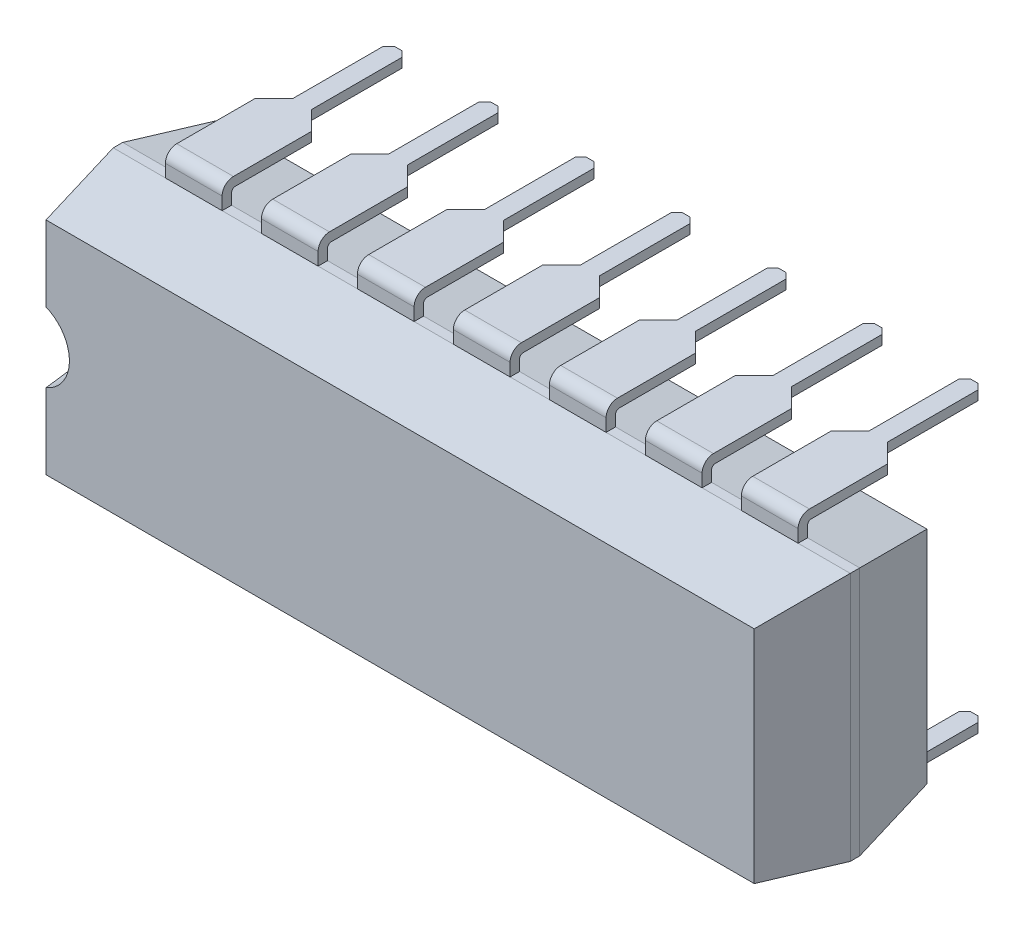
from build123d import *

# Parameters (mm, degrees)
SZKIC1_W                   = 9.75
SZKIC1_H                   = 3.3
WYCI_GNI_CIE1_DEPTH        = 5.08
SZKIC2_W                   = 9.75
SZKIC2_H                   = 5.08
WYCI_GNI_CIE2_DEPTH        = 3.3
SZKIC3_W                   = 5.08
SZKIC3_H                   = 6.6
WYCI_GNI_CIE3_DEPTH        = 9.75
SZKIC6_W                   = 19.5
SZKIC6_H                   = 6.6
WYTNIJ_WYCI_GNI_CIE1_DEPTH = 0.51
SFAZOWANIE1_SIZE           = 2.16
SFAZOWANIE1_SIZE2          = 0.380866278
SFAZOWANIE2_SIZE           = 2.16
SFAZOWANIE2_SIZE2          = 0.380866278
SFAZOWANIE3_SIZE           = 2.16
SFAZOWANIE3_SIZE2          = 0.380866278
SFAZOWANIE4_SIZE           = 2.16
SFAZOWANIE4_SIZE2          = 0.380866278
SFAZOWANIE5_SIZE           = 2.16
SFAZOWANIE5_SIZE2          = 0.380866278
SFAZOWANIE6_SIZE           = 2.16
SFAZOWANIE6_SIZE2          = 0.380866278
SFAZOWANIE8_SIZE           = 2.16
SFAZOWANIE8_SIZE2          = 0.380866278
SFAZOWANIE9_SIZE           = 2.16
SFAZOWANIE9_SIZE2          = 0.380866278
SZKIC8_R                   = 1
WYTNIJ_WYCI_GNI_CIE3_DEPTH = 1.3
SZKIC9_W                   = 1.5
SZKIC9_H                   = 0.25
WYCI_GNI_CIE4_DEPTH        = 0.635
SZKIC10_W                  = 1.5
SZKIC10_H                  = 0.25
WYCI_GNI_CIE5_DEPTH        = 2.62
SFAZOWANIE10_SIZE          = 0.5
SFAZOWANIE11_SIZE          = 0.5
SFAZOWANIE12_SIZE          = 0.5
SFAZOWANIE13_SIZE          = 0.5
SFAZOWANIE14_SIZE          = 0.5
SFAZOWANIE15_SIZE          = 0.5
SFAZOWANIE16_SIZE          = 0.5
SFAZOWANIE17_SIZE          = 0.5
SFAZOWANIE18_SIZE          = 0.5
SFAZOWANIE19_SIZE          = 0.5
SFAZOWANIE20_SIZE          = 0.5
SFAZOWANIE21_SIZE          = 0.5
SFAZOWANIE22_SIZE          = 0.5
SFAZOWANIE23_SIZE          = 0.5
SZKIC12_W                  = 0.5
SZKIC12_H                  = 0.25
WYCI_GNI_CIE6_DEPTH        = 2.54
SFAZOWANIE24_SIZE          = 0.15
SFAZOWANIE25_SIZE          = 0.15
SFAZOWANIE26_SIZE          = 0.15
SFAZOWANIE27_SIZE          = 0.15
SFAZOWANIE28_SIZE          = 0.15
SFAZOWANIE29_SIZE          = 0.15
SFAZOWANIE30_SIZE          = 0.15
SFAZOWANIE31_SIZE          = 0.15
SFAZOWANIE32_SIZE          = 0.15
SFAZOWANIE33_SIZE          = 0.15
SFAZOWANIE34_SIZE          = 0.15
SFAZOWANIE35_SIZE          = 0.15
SFAZOWANIE36_SIZE          = 0.15
SFAZOWANIE37_SIZE          = 0.15
SZKIC13_W                  = 1.5
SZKIC13_H                  = 0.25
WYCI_GNI_CIE7_DEPTH        = 0.635
SZKIC14_W                  = 1.5
SZKIC14_H                  = 0.25
WYCI_GNI_CIE8_DEPTH        = 2.62
SFAZOWANIE38_SIZE          = 0.5
SFAZOWANIE39_SIZE          = 0.5
SFAZOWANIE40_SIZE          = 0.5
SFAZOWANIE41_SIZE          = 0.5
SFAZOWANIE42_SIZE          = 0.5
SFAZOWANIE43_SIZE          = 0.5
SFAZOWANIE44_SIZE          = 0.5
SFAZOWANIE45_SIZE          = 0.5
SFAZOWANIE46_SIZE          = 0.5
SFAZOWANIE47_SIZE          = 0.5
SFAZOWANIE48_SIZE          = 0.5
SFAZOWANIE49_SIZE          = 0.5
SFAZOWANIE50_SIZE          = 0.5
SFAZOWANIE51_SIZE          = 0.5
SZKIC15_W                  = 0.5
SZKIC15_H                  = 0.25
WYCI_GNI_CIE9_DEPTH        = 2.54
SFAZOWANIE52_SIZE          = 0.15
SFAZOWANIE53_SIZE          = 0.15
SFAZOWANIE54_SIZE          = 0.15
SFAZOWANIE55_SIZE          = 0.15
SFAZOWANIE56_SIZE          = 0.15
SFAZOWANIE57_SIZE          = 0.15
SFAZOWANIE58_SIZE          = 0.15
SFAZOWANIE59_SIZE          = 0.15
SFAZOWANIE60_SIZE          = 0.15
SFAZOWANIE61_SIZE          = 0.15
SFAZOWANIE62_SIZE          = 0.15
SFAZOWANIE63_SIZE          = 0.15
SFAZOWANIE64_SIZE          = 0.15
SFAZOWANIE65_SIZE          = 0.15
ZAOKR_GLENIE1_R            = 0.3
ZAOKR_GLENIE2_R            = 0.3
ZAOKR_GLENIE3_R            = 0.3
ZAOKR_GLENIE4_R            = 0.3
ZAOKR_GLENIE5_R            = 0.3
ZAOKR_GLENIE6_R            = 0.3
ZAOKR_GLENIE7_R            = 0.3
ZAOKR_GLENIE8_R            = 0.3
ZAOKR_GLENIE9_R            = 0.3
ZAOKR_GLENIE10_R           = 0.3
ZAOKR_GLENIE11_R           = 0.3
ZAOKR_GLENIE12_R           = 0.3
ZAOKR_GLENIE13_R           = 0.3
ZAOKR_GLENIE14_R           = 0.3
ZAOKR_GLENIE15_R           = 0.1
ZAOKR_GLENIE16_R           = 0.1
ZAOKR_GLENIE17_R           = 0.1
ZAOKR_GLENIE18_R           = 0.1
ZAOKR_GLENIE19_R           = 0.1
ZAOKR_GLENIE20_R           = 0.1
ZAOKR_GLENIE21_R           = 0.1
ZAOKR_GLENIE22_R           = 0.1
ZAOKR_GLENIE23_R           = 0.1
ZAOKR_GLENIE24_R           = 0.1
ZAOKR_GLENIE25_R           = 0.1
ZAOKR_GLENIE26_R           = 0.1
ZAOKR_GLENIE27_R           = 0.1
ZAOKR_GLENIE28_R           = 0.1


with BuildPart() as part:
    # Szkic1 → Wyciągnięcie1 (new body)
    with BuildSketch(Plane.XY):
        with Locations((4.875, 1.65)):
            Rectangle(SZKIC1_W, SZKIC1_H)
    extrude(amount=WYCI_GNI_CIE1_DEPTH)

    # Szkic2 → Wyciągnięcie2 (add)
    with BuildSketch(Plane.XZ):
        with Locations((4.875, 2.54)):
            Rectangle(SZKIC2_W, SZKIC2_H)
    extrude(amount=WYCI_GNI_CIE2_DEPTH)

    # Szkic3 → Wyciągnięcie3 (add)
    with BuildSketch(Plane.ZY):
        with Locations((2.54, 0)):
            Rectangle(SZKIC3_W, SZKIC3_H)
    extrude(amount=WYCI_GNI_CIE3_DEPTH)

    # Szkic6 → Wytnij-wyciągnięcie1 (cut)
    with BuildSketch(Plane(origin=(0, 0, 0), x_dir=(-1, 0, 0), z_dir=(0, 0, -1))):
        Rectangle(SZKIC6_W, SZKIC6_H)
    extrude(amount=-WYTNIJ_WYCI_GNI_CIE1_DEPTH, mode=Mode.SUBTRACT)

    # Sfazowanie1
    sfazowanie1_edges = [part.edges().sort_by_distance(p)[0] for p in [
        (0, -3.3, 5.08),
    ]]
    sfazowanie1_side = [part.faces().sort_by_distance(p)[0] for p in [
        (0, -3.3, 2.795),
    ]]
    chamfer(sfazowanie1_edges, length=SFAZOWANIE1_SIZE, length2=SFAZOWANIE1_SIZE2, reference=sfazowanie1_side[0])

    # Sfazowanie2
    sfazowanie2_edges = [part.edges().sort_by_distance(p)[0] for p in [
        (0, -3.3, 0.51),
    ]]
    sfazowanie2_side = [part.faces().sort_by_distance(p)[0] for p in [
        (0, -3.3, 1.715),
    ]]
    chamfer(sfazowanie2_edges, length=SFAZOWANIE2_SIZE, length2=SFAZOWANIE2_SIZE2, reference=sfazowanie2_side[0])

    # Sfazowanie3
    sfazowanie3_edges = [part.edges().sort_by_distance(p)[0] for p in [
        (9.75, 0.190433139, 5.08),
    ]]
    sfazowanie3_side = [part.faces().sort_by_distance(p)[0] for p in [
        (9.75, 0.088971778, 2.795),
    ]]
    chamfer(sfazowanie3_edges, length=SFAZOWANIE3_SIZE, length2=SFAZOWANIE3_SIZE2, reference=sfazowanie3_side[0])

    # Sfazowanie4
    sfazowanie4_edges = [part.edges().sort_by_distance(p)[0] for p in [
        (9.75, 0.190433139, 0.51),
    ]]
    sfazowanie4_side = [part.faces().sort_by_distance(p)[0] for p in [
        (9.75, 0.084234553, 1.727875255),
    ]]
    chamfer(sfazowanie4_edges, length=SFAZOWANIE4_SIZE, length2=SFAZOWANIE4_SIZE2, reference=sfazowanie4_side[0])

    # Sfazowanie5
    sfazowanie5_edges = [part.edges().sort_by_distance(p)[0] for p in [
        (-0.190433139, 3.3, 5.08),
    ]]
    sfazowanie5_side = [part.faces().sort_by_distance(p)[0] for p in [
        (-0.089663523, 3.3, 2.795),
    ]]
    chamfer(sfazowanie5_edges, length=SFAZOWANIE5_SIZE, length2=SFAZOWANIE5_SIZE2, reference=sfazowanie5_side[0])

    # Sfazowanie6
    sfazowanie6_edges = [part.edges().sort_by_distance(p)[0] for p in [
        (-0.190433139, 3.3, 0.51),
    ]]
    sfazowanie6_side = [part.faces().sort_by_distance(p)[0] for p in [
        (-0.08497186, 3.3, 1.719282569),
    ]]
    chamfer(sfazowanie6_edges, length=SFAZOWANIE6_SIZE, length2=SFAZOWANIE6_SIZE2, reference=sfazowanie6_side[0])

    # Sfazowanie8
    sfazowanie8_edges = [part.edges().sort_by_distance(p)[0] for p in [
        (-9.75, 0, 0.51),
    ]]
    sfazowanie8_side = [part.faces().sort_by_distance(p)[0] for p in [
        (-9.75, 0, 2.795),
    ]]
    chamfer(sfazowanie8_edges, length=SFAZOWANIE8_SIZE, length2=SFAZOWANIE8_SIZE2, reference=sfazowanie8_side[0])

    # Sfazowanie9
    sfazowanie9_edges = [part.edges().sort_by_distance(p)[0] for p in [
        (-9.75, 0, 5.08),
    ]]
    sfazowanie9_side = [part.faces().sort_by_distance(p)[0] for p in [
        (-9.75, 0, 3.848547251),
    ]]
    chamfer(sfazowanie9_edges, length=SFAZOWANIE9_SIZE, length2=SFAZOWANIE9_SIZE2, reference=sfazowanie9_side[0])

    # Szkic8 → Wytnij-wyciągnięcie3 (cut)
    with BuildSketch(Plane.XY.offset(5.08)):
        with Locations((-9.75, 0)):
            Circle(SZKIC8_R)
    extrude(amount=-WYTNIJ_WYCI_GNI_CIE3_DEPTH, mode=Mode.SUBTRACT)

    # Szkic9 → Wyciągnięcie4 (add)
    with BuildSketch(Plane(origin=(0, 3.3, 0), x_dir=(-1, 0, 0), z_dir=(0, 1, 0))):
        with Locations((0, 2.795)):
            Rectangle(SZKIC9_W, SZKIC9_H)
        with Locations((-2.54, 2.795)):
            Rectangle(SZKIC9_W, SZKIC9_H)
        with Locations((-5.08, 2.795)):
            Rectangle(SZKIC9_W, SZKIC9_H)
        with Locations((-7.62, 2.795)):
            Rectangle(SZKIC9_W, SZKIC9_H)
        with Locations((2.54, 2.795)):
            Rectangle(SZKIC9_W, SZKIC9_H)
        with Locations((5.08, 2.795)):
            Rectangle(SZKIC9_W, SZKIC9_H)
        with Locations((7.62, 2.795)):
            Rectangle(SZKIC9_W, SZKIC9_H)
    extrude(amount=WYCI_GNI_CIE4_DEPTH)

    # Szkic10 → Wyciągnięcie5 (add)
    with BuildSketch(Plane(origin=(0, 0, 2.67), x_dir=(-1, 0, 0), z_dir=(0, 0, -1))):
        with Locations((0, 3.81)):
            Rectangle(SZKIC10_W, SZKIC10_H)
        with Locations((2.54, 3.81)):
            Rectangle(SZKIC10_W, SZKIC10_H)
        with Locations((5.08, 3.81)):
            Rectangle(SZKIC10_W, SZKIC10_H)
        with Locations((7.62, 3.81)):
            Rectangle(SZKIC10_W, SZKIC10_H)
        with Locations((-2.54, 3.81)):
            Rectangle(SZKIC10_W, SZKIC10_H)
        with Locations((-5.08, 3.81)):
            Rectangle(SZKIC10_W, SZKIC10_H)
        with Locations((-7.62, 3.81)):
            Rectangle(SZKIC10_W, SZKIC10_H)
    extrude(amount=WYCI_GNI_CIE5_DEPTH)

    # Sfazowanie10
    sfazowanie10_edges = [part.edges().sort_by_distance(p)[0] for p in [
        (-8.37, 3.81, 0.05),
    ]]
    chamfer(sfazowanie10_edges, length=SFAZOWANIE10_SIZE)

    # Sfazowanie11
    sfazowanie11_edges = [part.edges().sort_by_distance(p)[0] for p in [
        (-6.87, 3.81, 0.05),
    ]]
    chamfer(sfazowanie11_edges, length=SFAZOWANIE11_SIZE)

    # Sfazowanie12
    sfazowanie12_edges = [part.edges().sort_by_distance(p)[0] for p in [
        (-5.83, 3.81, 0.05),
    ]]
    chamfer(sfazowanie12_edges, length=SFAZOWANIE12_SIZE)

    # Sfazowanie13
    sfazowanie13_edges = [part.edges().sort_by_distance(p)[0] for p in [
        (-4.33, 3.81, 0.05),
    ]]
    chamfer(sfazowanie13_edges, length=SFAZOWANIE13_SIZE)

    # Sfazowanie14
    sfazowanie14_edges = [part.edges().sort_by_distance(p)[0] for p in [
        (-3.29, 3.81, 0.05),
    ]]
    chamfer(sfazowanie14_edges, length=SFAZOWANIE14_SIZE)

    # Sfazowanie15
    sfazowanie15_edges = [part.edges().sort_by_distance(p)[0] for p in [
        (-1.79, 3.81, 0.05),
    ]]
    chamfer(sfazowanie15_edges, length=SFAZOWANIE15_SIZE)

    # Sfazowanie16
    sfazowanie16_edges = [part.edges().sort_by_distance(p)[0] for p in [
        (-0.75, 3.81, 0.05),
    ]]
    chamfer(sfazowanie16_edges, length=SFAZOWANIE16_SIZE)

    # Sfazowanie17
    sfazowanie17_edges = [part.edges().sort_by_distance(p)[0] for p in [
        (0.75, 3.81, 0.05),
    ]]
    chamfer(sfazowanie17_edges, length=SFAZOWANIE17_SIZE)

    # Sfazowanie18
    sfazowanie18_edges = [part.edges().sort_by_distance(p)[0] for p in [
        (1.79, 3.81, 0.05),
    ]]
    chamfer(sfazowanie18_edges, length=SFAZOWANIE18_SIZE)

    # Sfazowanie19
    sfazowanie19_edges = [part.edges().sort_by_distance(p)[0] for p in [
        (3.29, 3.81, 0.05),
    ]]
    chamfer(sfazowanie19_edges, length=SFAZOWANIE19_SIZE)

    # Sfazowanie20
    sfazowanie20_edges = [part.edges().sort_by_distance(p)[0] for p in [
        (4.33, 3.81, 0.05),
    ]]
    chamfer(sfazowanie20_edges, length=SFAZOWANIE20_SIZE)

    # Sfazowanie21
    sfazowanie21_edges = [part.edges().sort_by_distance(p)[0] for p in [
        (5.83, 3.81, 0.05),
    ]]
    chamfer(sfazowanie21_edges, length=SFAZOWANIE21_SIZE)

    # Sfazowanie22
    sfazowanie22_edges = [part.edges().sort_by_distance(p)[0] for p in [
        (6.87, 3.81, 0.05),
    ]]
    chamfer(sfazowanie22_edges, length=SFAZOWANIE22_SIZE)

    # Sfazowanie23
    sfazowanie23_edges = [part.edges().sort_by_distance(p)[0] for p in [
        (8.37, 3.81, 0.05),
    ]]
    chamfer(sfazowanie23_edges, length=SFAZOWANIE23_SIZE)

    # Szkic12 → Wyciągnięcie6 (add)
    with BuildSketch(Plane(origin=(0, 0, 0.05), x_dir=(-1, 0, 0), z_dir=(0, 0, -1))):
        with Locations((0, 3.81)):
            Rectangle(SZKIC12_W, SZKIC12_H)
        with Locations((2.54, 3.81)):
            Rectangle(SZKIC12_W, SZKIC12_H)
        with Locations((5.08, 3.81)):
            Rectangle(SZKIC12_W, SZKIC12_H)
        with Locations((7.62, 3.81)):
            Rectangle(SZKIC12_W, SZKIC12_H)
        with Locations((-2.54, 3.81)):
            Rectangle(SZKIC12_W, SZKIC12_H)
        with Locations((-5.08, 3.81)):
            Rectangle(SZKIC12_W, SZKIC12_H)
        with Locations((-7.62, 3.81)):
            Rectangle(SZKIC12_W, SZKIC12_H)
    extrude(amount=WYCI_GNI_CIE6_DEPTH)

    # Sfazowanie24
    sfazowanie24_edges = [part.edges().sort_by_distance(p)[0] for p in [
        (-7.87, 3.81, -2.49),
    ]]
    chamfer(sfazowanie24_edges, length=SFAZOWANIE24_SIZE)

    # Sfazowanie25
    sfazowanie25_edges = [part.edges().sort_by_distance(p)[0] for p in [
        (-7.37, 3.81, -2.49),
    ]]
    chamfer(sfazowanie25_edges, length=SFAZOWANIE25_SIZE)

    # Sfazowanie26
    sfazowanie26_edges = [part.edges().sort_by_distance(p)[0] for p in [
        (-5.33, 3.81, -2.49),
    ]]
    chamfer(sfazowanie26_edges, length=SFAZOWANIE26_SIZE)

    # Sfazowanie27
    sfazowanie27_edges = [part.edges().sort_by_distance(p)[0] for p in [
        (-4.83, 3.81, -2.49),
    ]]
    chamfer(sfazowanie27_edges, length=SFAZOWANIE27_SIZE)

    # Sfazowanie28
    sfazowanie28_edges = [part.edges().sort_by_distance(p)[0] for p in [
        (-2.79, 3.81, -2.49),
    ]]
    chamfer(sfazowanie28_edges, length=SFAZOWANIE28_SIZE)

    # Sfazowanie29
    sfazowanie29_edges = [part.edges().sort_by_distance(p)[0] for p in [
        (-2.29, 3.81, -2.49),
    ]]
    chamfer(sfazowanie29_edges, length=SFAZOWANIE29_SIZE)

    # Sfazowanie30
    sfazowanie30_edges = [part.edges().sort_by_distance(p)[0] for p in [
        (-0.25, 3.81, -2.49),
    ]]
    chamfer(sfazowanie30_edges, length=SFAZOWANIE30_SIZE)

    # Sfazowanie31
    sfazowanie31_edges = [part.edges().sort_by_distance(p)[0] for p in [
        (0.25, 3.81, -2.49),
    ]]
    chamfer(sfazowanie31_edges, length=SFAZOWANIE31_SIZE)

    # Sfazowanie32
    sfazowanie32_edges = [part.edges().sort_by_distance(p)[0] for p in [
        (2.29, 3.81, -2.49),
    ]]
    chamfer(sfazowanie32_edges, length=SFAZOWANIE32_SIZE)

    # Sfazowanie33
    sfazowanie33_edges = [part.edges().sort_by_distance(p)[0] for p in [
        (2.79, 3.81, -2.49),
    ]]
    chamfer(sfazowanie33_edges, length=SFAZOWANIE33_SIZE)

    # Sfazowanie34
    sfazowanie34_edges = [part.edges().sort_by_distance(p)[0] for p in [
        (4.83, 3.81, -2.49),
    ]]
    chamfer(sfazowanie34_edges, length=SFAZOWANIE34_SIZE)

    # Sfazowanie35
    sfazowanie35_edges = [part.edges().sort_by_distance(p)[0] for p in [
        (5.33, 3.81, -2.49),
    ]]
    chamfer(sfazowanie35_edges, length=SFAZOWANIE35_SIZE)

    # Sfazowanie36
    sfazowanie36_edges = [part.edges().sort_by_distance(p)[0] for p in [
        (7.37, 3.81, -2.49),
    ]]
    chamfer(sfazowanie36_edges, length=SFAZOWANIE36_SIZE)

    # Sfazowanie37
    sfazowanie37_edges = [part.edges().sort_by_distance(p)[0] for p in [
        (7.87, 3.81, -2.49),
    ]]
    chamfer(sfazowanie37_edges, length=SFAZOWANIE37_SIZE)

    # Szkic13 → Wyciągnięcie7 (add)
    with BuildSketch(Plane.XZ.offset(3.3)):
        with Locations((0, 2.795)):
            Rectangle(SZKIC13_W, SZKIC13_H)
        with Locations((2.54, 2.795)):
            Rectangle(SZKIC13_W, SZKIC13_H)
        with Locations((5.08, 2.795)):
            Rectangle(SZKIC13_W, SZKIC13_H)
        with Locations((7.62, 2.795)):
            Rectangle(SZKIC13_W, SZKIC13_H)
        with Locations((-2.54, 2.795)):
            Rectangle(SZKIC13_W, SZKIC13_H)
        with Locations((-5.08, 2.795)):
            Rectangle(SZKIC13_W, SZKIC13_H)
        with Locations((-7.62, 2.795)):
            Rectangle(SZKIC13_W, SZKIC13_H)
    extrude(amount=WYCI_GNI_CIE7_DEPTH)

    # Szkic14 → Wyciągnięcie8 (add)
    with BuildSketch(Plane(origin=(0, 0, 2.67), x_dir=(-1, 0, 0), z_dir=(0, 0, -1))):
        with Locations((0, -3.81)):
            Rectangle(SZKIC14_W, SZKIC14_H)
        with Locations((2.54, -3.81)):
            Rectangle(SZKIC14_W, SZKIC14_H)
        with Locations((5.08, -3.81)):
            Rectangle(SZKIC14_W, SZKIC14_H)
        with Locations((7.62, -3.81)):
            Rectangle(SZKIC14_W, SZKIC14_H)
        with Locations((-2.54, -3.81)):
            Rectangle(SZKIC14_W, SZKIC14_H)
        with Locations((-5.08, -3.81)):
            Rectangle(SZKIC14_W, SZKIC14_H)
        with Locations((-7.62, -3.81)):
            Rectangle(SZKIC14_W, SZKIC14_H)
    extrude(amount=WYCI_GNI_CIE8_DEPTH)

    # Sfazowanie38
    sfazowanie38_edges = [part.edges().sort_by_distance(p)[0] for p in [
        (8.37, -3.81, 0.05),
    ]]
    chamfer(sfazowanie38_edges, length=SFAZOWANIE38_SIZE)

    # Sfazowanie39
    sfazowanie39_edges = [part.edges().sort_by_distance(p)[0] for p in [
        (6.87, -3.81, 0.05),
    ]]
    chamfer(sfazowanie39_edges, length=SFAZOWANIE39_SIZE)

    # Sfazowanie40
    sfazowanie40_edges = [part.edges().sort_by_distance(p)[0] for p in [
        (5.83, -3.81, 0.05),
    ]]
    chamfer(sfazowanie40_edges, length=SFAZOWANIE40_SIZE)

    # Sfazowanie41
    sfazowanie41_edges = [part.edges().sort_by_distance(p)[0] for p in [
        (4.33, -3.81, 0.05),
    ]]
    chamfer(sfazowanie41_edges, length=SFAZOWANIE41_SIZE)

    # Sfazowanie42
    sfazowanie42_edges = [part.edges().sort_by_distance(p)[0] for p in [
        (3.29, -3.81, 0.05),
    ]]
    chamfer(sfazowanie42_edges, length=SFAZOWANIE42_SIZE)

    # Sfazowanie43
    sfazowanie43_edges = [part.edges().sort_by_distance(p)[0] for p in [
        (1.79, -3.81, 0.05),
    ]]
    chamfer(sfazowanie43_edges, length=SFAZOWANIE43_SIZE)

    # Sfazowanie44
    sfazowanie44_edges = [part.edges().sort_by_distance(p)[0] for p in [
        (0.75, -3.81, 0.05),
    ]]
    chamfer(sfazowanie44_edges, length=SFAZOWANIE44_SIZE)

    # Sfazowanie45
    sfazowanie45_edges = [part.edges().sort_by_distance(p)[0] for p in [
        (-0.75, -3.81, 0.05),
    ]]
    chamfer(sfazowanie45_edges, length=SFAZOWANIE45_SIZE)

    # Sfazowanie46
    sfazowanie46_edges = [part.edges().sort_by_distance(p)[0] for p in [
        (-1.79, -3.81, 0.05),
    ]]
    chamfer(sfazowanie46_edges, length=SFAZOWANIE46_SIZE)

    # Sfazowanie47
    sfazowanie47_edges = [part.edges().sort_by_distance(p)[0] for p in [
        (-3.29, -3.81, 0.05),
    ]]
    chamfer(sfazowanie47_edges, length=SFAZOWANIE47_SIZE)

    # Sfazowanie48
    sfazowanie48_edges = [part.edges().sort_by_distance(p)[0] for p in [
        (-4.33, -3.81, 0.05),
    ]]
    chamfer(sfazowanie48_edges, length=SFAZOWANIE48_SIZE)

    # Sfazowanie49
    sfazowanie49_edges = [part.edges().sort_by_distance(p)[0] for p in [
        (-5.83, -3.81, 0.05),
    ]]
    chamfer(sfazowanie49_edges, length=SFAZOWANIE49_SIZE)

    # Sfazowanie50
    sfazowanie50_edges = [part.edges().sort_by_distance(p)[0] for p in [
        (-6.87, -3.81, 0.05),
    ]]
    chamfer(sfazowanie50_edges, length=SFAZOWANIE50_SIZE)

    # Sfazowanie51
    sfazowanie51_edges = [part.edges().sort_by_distance(p)[0] for p in [
        (-8.37, -3.81, 0.05),
    ]]
    chamfer(sfazowanie51_edges, length=SFAZOWANIE51_SIZE)

    # Szkic15 → Wyciągnięcie9 (add)
    with BuildSketch(Plane(origin=(0, 0, 0.05), x_dir=(-1, 0, 0), z_dir=(0, 0, -1))):
        with Locations((0, -3.81)):
            Rectangle(SZKIC15_W, SZKIC15_H)
        with Locations((2.54, -3.81)):
            Rectangle(SZKIC15_W, SZKIC15_H)
        with Locations((5.08, -3.81)):
            Rectangle(SZKIC15_W, SZKIC15_H)
        with Locations((7.62, -3.81)):
            Rectangle(SZKIC15_W, SZKIC15_H)
        with Locations((-2.54, -3.81)):
            Rectangle(SZKIC15_W, SZKIC15_H)
        with Locations((-5.08, -3.81)):
            Rectangle(SZKIC15_W, SZKIC15_H)
        with Locations((-7.62, -3.81)):
            Rectangle(SZKIC15_W, SZKIC15_H)
    extrude(amount=WYCI_GNI_CIE9_DEPTH)

    # Sfazowanie52
    sfazowanie52_edges = [part.edges().sort_by_distance(p)[0] for p in [
        (-7.87, -3.81, -2.49),
    ]]
    chamfer(sfazowanie52_edges, length=SFAZOWANIE52_SIZE)

    # Sfazowanie53
    sfazowanie53_edges = [part.edges().sort_by_distance(p)[0] for p in [
        (-7.37, -3.81, -2.49),
    ]]
    chamfer(sfazowanie53_edges, length=SFAZOWANIE53_SIZE)

    # Sfazowanie54
    sfazowanie54_edges = [part.edges().sort_by_distance(p)[0] for p in [
        (-5.33, -3.81, -2.49),
    ]]
    chamfer(sfazowanie54_edges, length=SFAZOWANIE54_SIZE)

    # Sfazowanie55
    sfazowanie55_edges = [part.edges().sort_by_distance(p)[0] for p in [
        (-4.83, -3.81, -2.49),
    ]]
    chamfer(sfazowanie55_edges, length=SFAZOWANIE55_SIZE)

    # Sfazowanie56
    sfazowanie56_edges = [part.edges().sort_by_distance(p)[0] for p in [
        (-2.79, -3.81, -2.49),
    ]]
    chamfer(sfazowanie56_edges, length=SFAZOWANIE56_SIZE)

    # Sfazowanie57
    sfazowanie57_edges = [part.edges().sort_by_distance(p)[0] for p in [
        (-2.29, -3.81, -2.49),
    ]]
    chamfer(sfazowanie57_edges, length=SFAZOWANIE57_SIZE)

    # Sfazowanie58
    sfazowanie58_edges = [part.edges().sort_by_distance(p)[0] for p in [
        (-0.25, -3.81, -2.49),
    ]]
    chamfer(sfazowanie58_edges, length=SFAZOWANIE58_SIZE)

    # Sfazowanie59
    sfazowanie59_edges = [part.edges().sort_by_distance(p)[0] for p in [
        (0.25, -3.81, -2.49),
    ]]
    chamfer(sfazowanie59_edges, length=SFAZOWANIE59_SIZE)

    # Sfazowanie60
    sfazowanie60_edges = [part.edges().sort_by_distance(p)[0] for p in [
        (2.29, -3.81, -2.49),
    ]]
    chamfer(sfazowanie60_edges, length=SFAZOWANIE60_SIZE)

    # Sfazowanie61
    sfazowanie61_edges = [part.edges().sort_by_distance(p)[0] for p in [
        (2.79, -3.81, -2.49),
    ]]
    chamfer(sfazowanie61_edges, length=SFAZOWANIE61_SIZE)

    # Sfazowanie62
    sfazowanie62_edges = [part.edges().sort_by_distance(p)[0] for p in [
        (4.83, -3.81, -2.49),
    ]]
    chamfer(sfazowanie62_edges, length=SFAZOWANIE62_SIZE)

    # Sfazowanie63
    sfazowanie63_edges = [part.edges().sort_by_distance(p)[0] for p in [
        (5.33, -3.81, -2.49),
    ]]
    chamfer(sfazowanie63_edges, length=SFAZOWANIE63_SIZE)

    # Sfazowanie64
    sfazowanie64_edges = [part.edges().sort_by_distance(p)[0] for p in [
        (7.37, -3.81, -2.49),
    ]]
    chamfer(sfazowanie64_edges, length=SFAZOWANIE64_SIZE)

    # Sfazowanie65
    sfazowanie65_edges = [part.edges().sort_by_distance(p)[0] for p in [
        (7.87, -3.81, -2.49),
    ]]
    chamfer(sfazowanie65_edges, length=SFAZOWANIE65_SIZE)

    # Zaokrąglenie1
    zaokr_glenie1_edges = [part.edges().sort_by_distance(p)[0] for p in [
        (0, 3.935, 2.92),
    ]]
    fillet(zaokr_glenie1_edges, radius=ZAOKR_GLENIE1_R)

    # Zaokrąglenie2
    zaokr_glenie2_edges = [part.edges().sort_by_distance(p)[0] for p in [
        (2.54, 3.935, 2.92),
    ]]
    fillet(zaokr_glenie2_edges, radius=ZAOKR_GLENIE2_R)

    # Zaokrąglenie3
    zaokr_glenie3_edges = [part.edges().sort_by_distance(p)[0] for p in [
        (5.08, 3.935, 2.92),
    ]]
    fillet(zaokr_glenie3_edges, radius=ZAOKR_GLENIE3_R)

    # Zaokrąglenie4
    zaokr_glenie4_edges = [part.edges().sort_by_distance(p)[0] for p in [
        (7.62, 3.935, 2.92),
    ]]
    fillet(zaokr_glenie4_edges, radius=ZAOKR_GLENIE4_R)

    # Zaokrąglenie5
    zaokr_glenie5_edges = [part.edges().sort_by_distance(p)[0] for p in [
        (-2.54, 3.935, 2.92),
    ]]
    fillet(zaokr_glenie5_edges, radius=ZAOKR_GLENIE5_R)

    # Zaokrąglenie6
    zaokr_glenie6_edges = [part.edges().sort_by_distance(p)[0] for p in [
        (-5.08, 3.935, 2.92),
    ]]
    fillet(zaokr_glenie6_edges, radius=ZAOKR_GLENIE6_R)

    # Zaokrąglenie7
    zaokr_glenie7_edges = [part.edges().sort_by_distance(p)[0] for p in [
        (-7.62, 3.935, 2.92),
    ]]
    fillet(zaokr_glenie7_edges, radius=ZAOKR_GLENIE7_R)

    # Zaokrąglenie8
    zaokr_glenie8_edges = [part.edges().sort_by_distance(p)[0] for p in [
        (7.62, -3.935, 2.92),
    ]]
    fillet(zaokr_glenie8_edges, radius=ZAOKR_GLENIE8_R)

    # Zaokrąglenie9
    zaokr_glenie9_edges = [part.edges().sort_by_distance(p)[0] for p in [
        (5.08, -3.935, 2.92),
    ]]
    fillet(zaokr_glenie9_edges, radius=ZAOKR_GLENIE9_R)

    # Zaokrąglenie10
    zaokr_glenie10_edges = [part.edges().sort_by_distance(p)[0] for p in [
        (2.54, -3.935, 2.92),
    ]]
    fillet(zaokr_glenie10_edges, radius=ZAOKR_GLENIE10_R)

    # Zaokrąglenie11
    zaokr_glenie11_edges = [part.edges().sort_by_distance(p)[0] for p in [
        (0, -3.935, 2.92),
    ]]
    fillet(zaokr_glenie11_edges, radius=ZAOKR_GLENIE11_R)

    # Zaokrąglenie12
    zaokr_glenie12_edges = [part.edges().sort_by_distance(p)[0] for p in [
        (-2.54, -3.935, 2.92),
    ]]
    fillet(zaokr_glenie12_edges, radius=ZAOKR_GLENIE12_R)

    # Zaokrąglenie13
    zaokr_glenie13_edges = [part.edges().sort_by_distance(p)[0] for p in [
        (-5.08, -3.935, 2.92),
    ]]
    fillet(zaokr_glenie13_edges, radius=ZAOKR_GLENIE13_R)

    # Zaokrąglenie14
    zaokr_glenie14_edges = [part.edges().sort_by_distance(p)[0] for p in [
        (-7.62, -3.935, 2.92),
    ]]
    fillet(zaokr_glenie14_edges, radius=ZAOKR_GLENIE14_R)

    # Zaokrąglenie15
    zaokr_glenie15_edges = [part.edges().sort_by_distance(p)[0] for p in [
        (-7.62, 3.685, 2.67),
    ]]
    fillet(zaokr_glenie15_edges, radius=ZAOKR_GLENIE15_R)

    # Zaokrąglenie16
    zaokr_glenie16_edges = [part.edges().sort_by_distance(p)[0] for p in [
        (-5.08, 3.685, 2.67),
    ]]
    fillet(zaokr_glenie16_edges, radius=ZAOKR_GLENIE16_R)

    # Zaokrąglenie17
    zaokr_glenie17_edges = [part.edges().sort_by_distance(p)[0] for p in [
        (-2.54, 3.685, 2.67),
    ]]
    fillet(zaokr_glenie17_edges, radius=ZAOKR_GLENIE17_R)

    # Zaokrąglenie18
    zaokr_glenie18_edges = [part.edges().sort_by_distance(p)[0] for p in [
        (0, 3.685, 2.67),
    ]]
    fillet(zaokr_glenie18_edges, radius=ZAOKR_GLENIE18_R)

    # Zaokrąglenie19
    zaokr_glenie19_edges = [part.edges().sort_by_distance(p)[0] for p in [
        (2.54, 3.685, 2.67),
    ]]
    fillet(zaokr_glenie19_edges, radius=ZAOKR_GLENIE19_R)

    # Zaokrąglenie20
    zaokr_glenie20_edges = [part.edges().sort_by_distance(p)[0] for p in [
        (5.08, 3.685, 2.67),
    ]]
    fillet(zaokr_glenie20_edges, radius=ZAOKR_GLENIE20_R)

    # Zaokrąglenie21
    zaokr_glenie21_edges = [part.edges().sort_by_distance(p)[0] for p in [
        (7.62, 3.685, 2.67),
    ]]
    fillet(zaokr_glenie21_edges, radius=ZAOKR_GLENIE21_R)

    # Zaokrąglenie22
    zaokr_glenie22_edges = [part.edges().sort_by_distance(p)[0] for p in [
        (-7.62, -3.685, 2.67),
    ]]
    fillet(zaokr_glenie22_edges, radius=ZAOKR_GLENIE22_R)

    # Zaokrąglenie23
    zaokr_glenie23_edges = [part.edges().sort_by_distance(p)[0] for p in [
        (-5.08, -3.685, 2.67),
    ]]
    fillet(zaokr_glenie23_edges, radius=ZAOKR_GLENIE23_R)

    # Zaokrąglenie24
    zaokr_glenie24_edges = [part.edges().sort_by_distance(p)[0] for p in [
        (-2.54, -3.685, 2.67),
    ]]
    fillet(zaokr_glenie24_edges, radius=ZAOKR_GLENIE24_R)

    # Zaokrąglenie25
    zaokr_glenie25_edges = [part.edges().sort_by_distance(p)[0] for p in [
        (0, -3.685, 2.67),
    ]]
    fillet(zaokr_glenie25_edges, radius=ZAOKR_GLENIE25_R)

    # Zaokrąglenie26
    zaokr_glenie26_edges = [part.edges().sort_by_distance(p)[0] for p in [
        (2.54, -3.685, 2.67),
    ]]
    fillet(zaokr_glenie26_edges, radius=ZAOKR_GLENIE26_R)

    # Zaokrąglenie27
    zaokr_glenie27_edges = [part.edges().sort_by_distance(p)[0] for p in [
        (5.08, -3.685, 2.67),
    ]]
    fillet(zaokr_glenie27_edges, radius=ZAOKR_GLENIE27_R)

    # Zaokrąglenie28
    zaokr_glenie28_edges = [part.edges().sort_by_distance(p)[0] for p in [
        (7.62, -3.685, 2.67),
    ]]
    fillet(zaokr_glenie28_edges, radius=ZAOKR_GLENIE28_R)


solid = part.part
